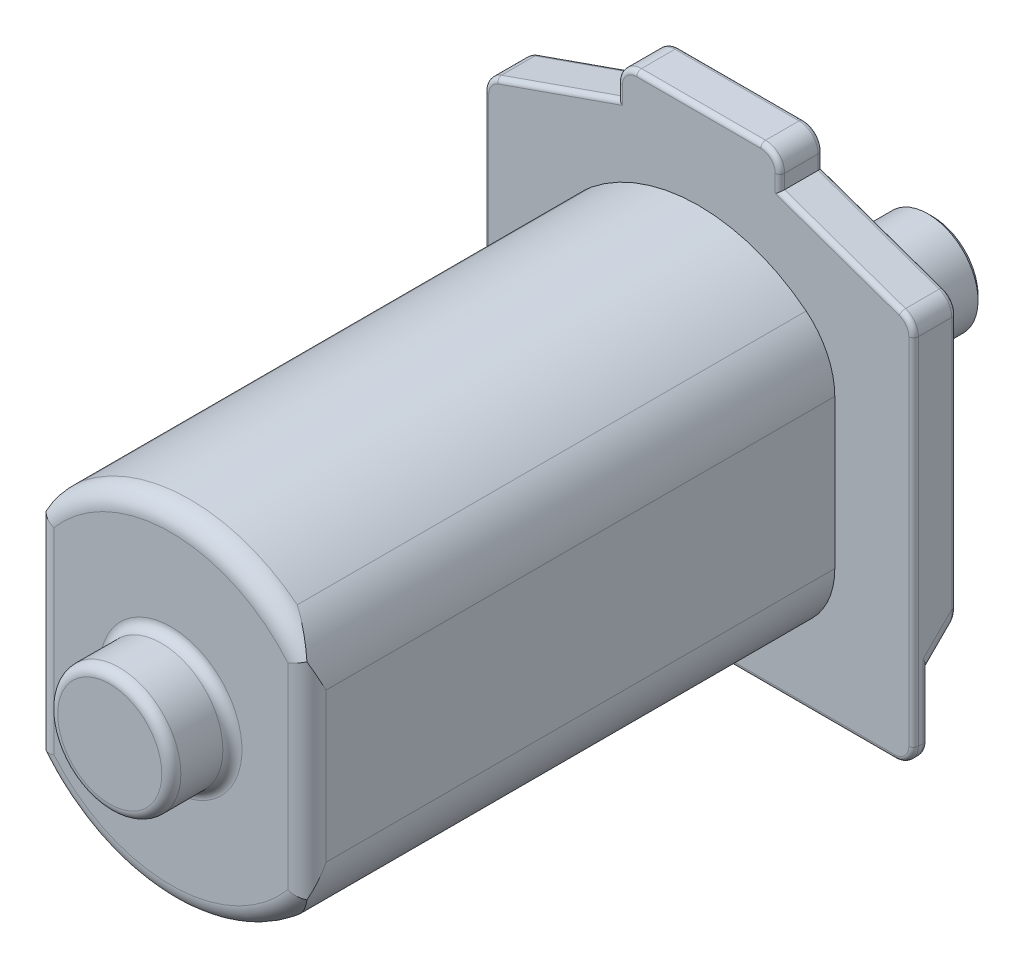
from build123d import *

# Parameters (mm, degrees)
SKETCH1_W           = 45
SKETCH1_H           = 48.976493044
BOSS_EXTRUDE1_DEPTH = 4.5
SKETCH2_W           = 14
SKETCH2_H           = 8.406511393
CUT_EXTRUDE1_DEPTH  = 36.377367274
SKETCH3_W           = 3
SKETCH3_H           = 7.335385762
CUT_EXTRUDE2_DEPTH  = 80.536772095
SKETCH4_W           = 14
SKETCH4_H           = 8.406511393
CUT_EXTRUDE3_DEPTH  = 36.377367274
BOSS_EXTRUDE2_DEPTH = 55.3
DRAFT1_ANGLE        = 45
DRAFT2_ANGLE        = 19.350680438
DRAFT3_ANGLE        = 19.350680438
SKETCH6_W           = 6.45
SKETCH6_H           = 6.4
FILLET1_R           = 2
FILLET2_START       = -55.3
FILLET2_DEPTH       = 55.3000001
CHAMFER1_SIZE       = 0.5
FILLET3_R           = 0.5
FILLET4_R           = 1


with BuildPart() as part:
    # Sketch1 → Boss-Extrude1 (new body)
    with BuildSketch(Plane(origin=(0, 0, -59.8), x_dir=(-1, 0, 0), z_dir=(0, 0, -1))):
        with Locations((0, 2.438656665)):
            Rectangle(SKETCH1_W, SKETCH1_H)
    extrude(amount=-BOSS_EXTRUDE1_DEPTH)

    # Sketch2 → Cut-Extrude1 (cut, through all)
    with BuildSketch(Plane.XY.offset(-55.3)):
        with Locations((-15.5, 22.72364749)):
            Rectangle(SKETCH2_W, SKETCH2_H)
    extrude(amount=-CUT_EXTRUDE1_DEPTH, mode=Mode.SUBTRACT)

    # Sketch3 → Cut-Extrude2 (cut, through all)
    with BuildSketch(Plane.ZY.offset(22.5)):
        with Locations((-58.3, -18.381896976)):
            Rectangle(SKETCH3_W, SKETCH3_H)
    extrude(amount=-CUT_EXTRUDE2_DEPTH, mode=Mode.SUBTRACT)

    # Sketch4 → Cut-Extrude3 (cut, through all)
    with BuildSketch(Plane.XY.offset(-55.3)):
        with Locations((15.5, 22.72364749)):
            Rectangle(SKETCH4_W, SKETCH4_H)
    extrude(amount=-CUT_EXTRUDE3_DEPTH, mode=Mode.SUBTRACT)

    # Sketch5 → Boss-Extrude2 (add)
    with BuildSketch(Plane.XY.offset(-55.3)):
        with BuildLine():
            Line((-14.247806849, -11), (-14.247806849, 11))
            ThreePointArc((-14.247806849, 11), (0, 18), (14.247806849, 11))
            Line((14.247806849, 11), (14.247806849, -11))
            ThreePointArc((14.247806849, -11), (0, -18), (-14.247806849, -11))
        make_face()
    extrude(amount=BOSS_EXTRUDE2_DEPTH)

    # Draft1
    draft1_faces = [part.faces().sort_by_distance(p)[0] for p in [
        (0, -14.714204095, -58.3),
    ]]
    draft(draft1_faces, Plane(origin=(22.5, -22.049589857, -56.8), x_dir=(-1, 0, 0), z_dir=(0, 0, -1)), DRAFT1_ANGLE)

    # Draft2
    draft2_faces = [part.faces().sort_by_distance(p)[0] for p in [
        (-15.5, 18.520391794, -57.55),
    ]]
    draft(draft2_faces, Plane(origin=(-22.5, -22.049589857, -55.3), x_dir=(0, 0, -1), z_dir=(-1, 0, 0)), DRAFT2_ANGLE)

    # Draft3
    draft3_faces = [part.faces().sort_by_distance(p)[0] for p in [
        (15.5, 18.520391794, -57.55),
    ]]
    draft(draft3_faces, Plane(origin=(22.5, 26.926903187, -55.3), x_dir=(0, 0, 1), z_dir=(1, 0, 0)), DRAFT3_ANGLE)

    # Sketch6 → Revolve1 (revolve)
    with BuildSketch(Plane(origin=(0, 0, 0), x_dir=(1, 0, 0), z_dir=(0, 1, 0))):
        with Locations((3.225, -3.2)):
            Rectangle(SKETCH6_W, SKETCH6_H)
    revolve(axis=Axis((0, 0, 0), (0, 0, 1)))

    # Sketch7 → Revolve2 (revolve)
    with BuildSketch(Plane.XZ, mode=Mode.PRIVATE) as revolve2_sk:
        Polygon((9.65, -59.8), (0, -59.8), (0, -79.8), (5.25, -79.8), (5.25, -65.5), (9.65, -65.5), align=None)
    revolve(revolve2_sk.sketch.rotate(Axis((0, 0, -59.8), (0, 0, -1)), 270), axis=Axis((0, 0, -59.8), (0, 0, -1)))

    # Fillet1
    fillet1_edges = [part.edges().sort_by_distance(p)[0] for p in [
        (-22.5, 18.520391794, -57.55),
        (-8.5, 26.926903187, -57.55),
        (22.5, -13.214204095, -58.3),
        (-22.5, -13.214204095, -58.3),
        (8.5, 26.926903187, -57.55),
        (22.5, 18.520391794, -57.55),
        (0, -18, 0),
        (14.247806849, 0, 0),
        (0, 18, 0),
        (-14.247806849, 0, 0),
        (-22.5, -22.049589857, -56.05),
        (22.5, -22.049589857, -56.05),
    ]]
    fillet(fillet1_edges, radius=FILLET1_R)

    # Fillet2: read off the stored shape, not the designer's step
    # Fillet2 outline → Fillet2 (cut)
    with BuildSketch(Plane.XY.offset(FILLET2_START)):
        with BuildLine():
            ThreePointArc((14.247806849, 11), (12.838090271, 12.616791914), (11.246052328, 14.054405254))
            ThreePointArc((11.246052328, 14.054405254), (13.458422767, 11.273117359), (14.247806849, 7.808002919))
            Line((14.247806849, 7.808002919), (14.247806849, 11))
        make_face()
        with BuildLine():
            ThreePointArc((-14.247806849, 7.808002919), (-13.458422767, 11.273117359), (-11.246052328, 14.054405254))
            ThreePointArc((-11.246052328, 14.054405254), (-12.838090271, 12.616791914), (-14.247806849, 11))
            Line((-14.247806849, 11), (-14.247806849, 7.808002919))
        make_face()
        with BuildLine():
            Line((14.247806849, -11), (14.247806849, -7.808002919))
            ThreePointArc((14.247806849, -7.808002919), (13.458422767, -11.273117359), (11.246052328, -14.054405254))
            ThreePointArc((11.246052328, -14.054405254), (12.838090271, -12.616791914), (14.247806849, -11))
        make_face()
        with BuildLine():
            ThreePointArc((-11.246052328, -14.054405254), (-13.458422767, -11.273117359), (-14.247806849, -7.808002919))
            Line((-14.247806849, -7.808002919), (-14.247806849, -11))
            ThreePointArc((-14.247806849, -11), (-12.838090271, -12.616791914), (-11.246052328, -14.054405254))
        make_face()
    extrude(amount=FILLET2_DEPTH, mode=Mode.SUBTRACT)

    # Chamfer1
    chamfer1_edges = [part.edges().sort_by_distance(p)[0] for p in [
        (0, -5.25, -79.8),
    ]]
    chamfer(chamfer1_edges, length=CHAMFER1_SIZE)

    # Fillet3
    fillet3_edges = [part.edges().sort_by_distance(p)[0] for p in [
        (8.5, 24.181965906, -55.3),
        (-8.5, 24.181965906, -55.3),
        (7.914213562, 26.341116749, -55.3),
        (-7.914213562, 26.341116749, -55.3),
        (0, 26.926903187, -55.3),
        (-14.831349093, 21.213532615, -55.3),
        (-22.131777616, 18.25943781, -55.3),
        (-22.5, -1.473284855, -55.3),
        (-21.914213562, -21.46380342, -55.3),
        (0, -22.049589857, -55.3),
        (21.914213562, -21.46380342, -55.3),
        (22.5, -1.473284855, -55.3),
        (14.831349093, 21.213532615, -55.3),
        (22.131777616, 18.25943781, -55.3),
        (22.5, -15.967683414, -56.8),
        (-22.5, -15.967683414, -56.8),
        (21.914213562, -21.46380342, -56.8),
        (-21.914213562, -21.46380342, -56.8),
        (0, -22.049589857, -56.8),
        (8.5, 24.181965906, -59.8),
        (7.914213562, 26.341116749, -59.8),
        (0, 26.926903187, -59.8),
        (-7.914213562, 26.341116749, -59.8),
        (-8.5, 24.181965906, -59.8),
        (14.831349093, 21.213532615, -59.8),
        (22.131777616, 18.25943781, -59.8),
        (22.5, 4.108621588, -59.8),
        (22.026592034, -10.713079224, -59.8),
        (0, -11.714204095, -59.8),
        (-22.026592034, -10.713079224, -59.8),
        (-22.5, 4.108621588, -59.8),
        (-22.131777616, 18.25943781, -59.8),
        (-14.831349093, 21.213532615, -59.8),
    ]]
    fillet(fillet3_edges, radius=FILLET3_R)

    # Fillet4
    fillet4_edges = [part.edges().sort_by_distance(p)[0] for p in [
        (-6.45, 0, 0),
        (-6.45, 0, 6.4),
        (0, -9.65, -65.5),
    ]]
    fillet(fillet4_edges, radius=FILLET4_R)


solid = part.part
